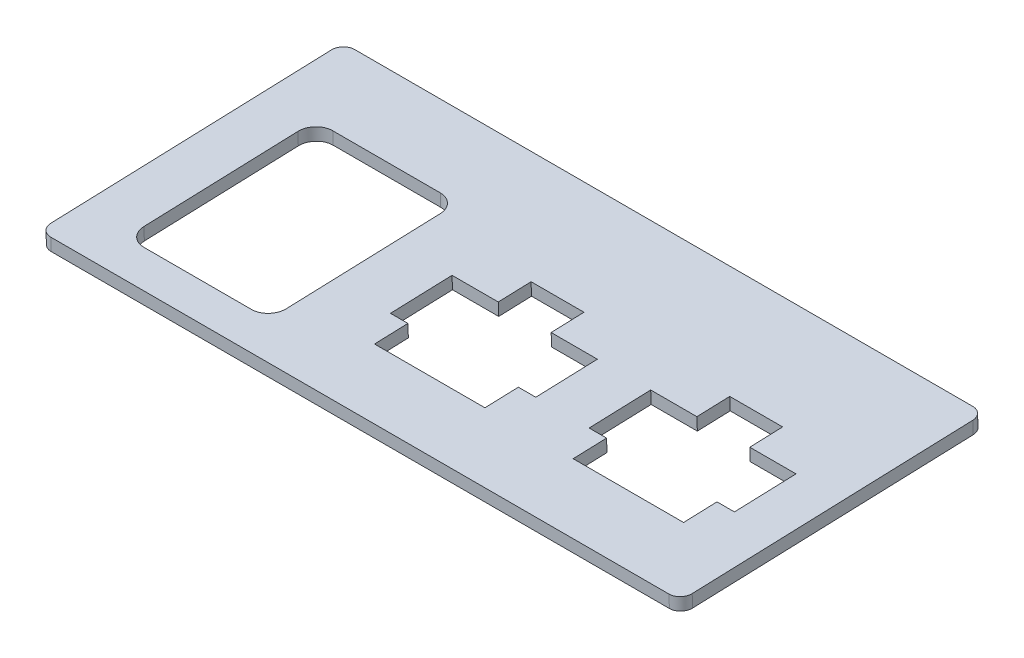
from build123d import *

# Parameters (mm, degrees)
SKETCH1_W           = 110.35
SKETCH1_H           = 52.301351528
BOSS_EXTRUDE1_DEPTH = 2.2
CUT_EXTRUDE1_REACH  = 75.143
FILLET1_R           = 2


with BuildPart() as part:
    # Sketch1 → Boss-Extrude1 (new body)
    with BuildSketch(Plane(origin=(0, -71.98718802, -2.513847999), x_dir=(1, 0, 0), z_dir=(0, 0.9993908270190958, 0.03489949670250105))):
        with Locations((0, 21.739080484)):
            Rectangle(SKETCH1_W, SKETCH1_H)
    extrude(amount=BOSS_EXTRUDE1_DEPTH)

    # Sketch2 → Cut-Extrude1 (cut, up to next)
    with BuildSketch(Plane(origin=(0, -71.98718802, -2.513847999), x_dir=(1, 0, 0), z_dir=(0, -0.9993908270190958, -0.03489949670250106)), mode=Mode.PRIVATE) as cut_extrude1_sk1:
        Polygon((-4.05, -23.464080484), (-4.05, -29.114080484), (5.05, -29.114080484), (5.05, -23.464080484), (13, -23.464080484), (13, -12.864080484), (10, -12.864080484), (10, -7.114080484), (-9, -7.114080484), (-9, -12.864080484), (-12, -12.864080484), (-12, -23.464080484), align=None)
    cut_extrude1_tool1 = extrude(cut_extrude1_sk1.sketch, amount=-CUT_EXTRUDE1_REACH, mode=Mode.PRIVATE) & part.part
    # Sketch2 → Cut-Extrude1 (cut, up to next)
    with BuildSketch(Plane(origin=(0, -71.98718802, -2.513847999), x_dir=(1, 0, 0), z_dir=(0, -0.9993908270190958, -0.03489949670250106)), mode=Mode.PRIVATE) as cut_extrude1_sk2:
        with BuildLine():
            Line((-43.425, -1.864080484), (-24.925, -1.864080484))
            ThreePointArc((-24.925, -1.864080484), (-22.803679656, -2.74276014), (-21.925, -4.864080484))
            Line((-21.925, -4.864080484), (-21.925, -31.364080484))
            ThreePointArc((-21.925, -31.364080484), (-22.803679656, -33.485400827), (-24.925, -34.364080484))
            Line((-24.925, -34.364080484), (-43.425, -34.364080484))
            ThreePointArc((-43.425, -34.364080484), (-45.546320344, -33.485400827), (-46.425, -31.364080484))
            Line((-46.425, -31.364080484), (-46.425, -4.864080484))
            ThreePointArc((-46.425, -4.864080484), (-45.546320344, -2.74276014), (-43.425, -1.864080484))
        make_face()
    cut_extrude1_tool2 = extrude(cut_extrude1_sk2.sketch, amount=-CUT_EXTRUDE1_REACH, mode=Mode.PRIVATE) & part.part
    # Sketch2 → Cut-Extrude1 (cut, up to next)
    with BuildSketch(Plane(origin=(0, -71.98718802, -2.513847999), x_dir=(1, 0, 0), z_dir=(0, -0.9993908270190958, -0.03489949670250106)), mode=Mode.PRIVATE) as cut_extrude1_sk3:
        Polygon((30.125, -23.464080484), (22.175, -23.464080484), (22.175, -12.864080484), (25.175, -12.864080484), (25.175, -7.114080484), (44.175, -7.114080484), (44.175, -12.864080484), (47.175, -12.864080484), (47.175, -23.464080484), (39.225, -23.464080484), (39.225, -29.114080484), (30.125, -29.114080484), align=None)
    cut_extrude1_tool3 = extrude(cut_extrude1_sk3.sketch, amount=-CUT_EXTRUDE1_REACH, mode=Mode.PRIVATE) & part.part
    add(cut_extrude1_tool1.solids().sort_by_distance((0.5, -71.392246, -19.550769))[0], mode=Mode.SUBTRACT)
    add(cut_extrude1_tool2.solids().sort_by_distance((-34.175, -71.355016, -20.616894))[0], mode=Mode.SUBTRACT)
    add(cut_extrude1_tool3.solids().sort_by_distance((34.675, -71.392246, -19.550769))[0], mode=Mode.SUBTRACT)

    # Fillet1
    fillet1_edges = [part.edges().sort_by_distance(p)[0] for p in [
        (-55.175, -71.041820566, 1.933449303),
        (55.175, -71.041820566, 1.933449303),
        (55.175, -69.21652972, -50.336041655),
        (-55.175, -69.21652972, -50.336041655),
    ]]
    fillet(fillet1_edges, radius=FILLET1_R)


solid = part.part
